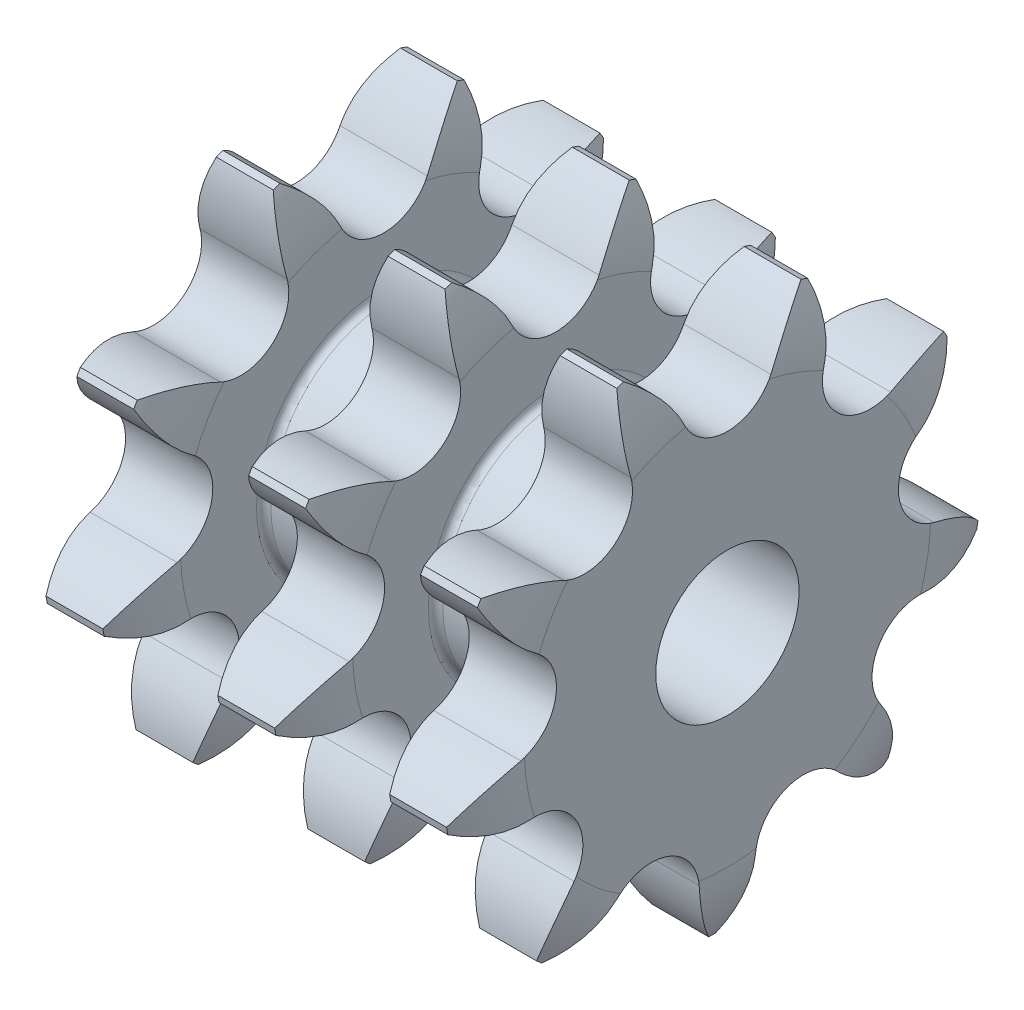
from build123d import *

# Parameters (mm, degrees)
GROOVES_COUNT   = 2
GROOVES_PITCH   = 14.38
TOOTHCUT_DEPTH  = 49.118649805
TEETHCUTS_COUNT = 9
TEETHCUTS_ANGLE = 320
BORSKE_R        = 6
BORE_DEPTH      = 38.2605


with BuildPart() as part:
    # BasProSke → Base-Revolve (revolve)
    with BuildSketch(Plane(origin=(0, 0, 0), x_dir=(1, 0, 0), z_dir=(0, 1, 0))):
        with BuildLine():
            Line((0, 0), (0, 16.992856303))
            ThreePointArc((0, 16.992856303), (0.321571182, 19.832662635), (1.27, 22.528657961))
            Line((1.27, 22.528657961), (34.79, 22.528657961))
            ThreePointArc((34.79, 22.528657961), (35.738428818, 19.832662635), (36.06, 16.992856303))
            Line((36.06, 16.992856303), (36.06, 0))
            Line((36.06, 0), (0, 0))
        make_face()
    revolve(axis=Axis((-10, 0, 0), (1, 0, 0)))

    # GrvSke → Groove (revolve, cut)
    with BuildSketch(Plane(origin=(0, 0, 0), x_dir=(1, 0, 0), z_dir=(0, 1, 0))):
        with BuildLine():
            Line((7.3, 16.992856303), (7.3, 10.646481635))
            ThreePointArc((7.3, 10.646481635), (7.475735931, 10.222217566), (7.9, 10.046481635))
            Line((7.9, 10.046481635), (13.78, 10.046481635))
            ThreePointArc((13.78, 10.046481635), (14.204264069, 10.222217566), (14.38, 10.646481635))
            Line((14.38, 10.646481635), (14.38, 16.992856303))
            ThreePointArc((14.38, 16.992856303), (14.701571182, 19.832662635), (15.65, 22.528657961))
            Line((15.65, 22.528657961), (6.03, 22.528657961))
            ThreePointArc((6.03, 22.528657961), (6.978428818, 19.832662635), (7.3, 16.992856303))
        make_face()
    groove = revolve(axis=Axis((0, 0, 0), (1, 0, 0)), mode=Mode.SUBTRACT)

    # Grooves: Groove ×2
    with Locations(*[(i * GROOVES_PITCH, 0, 0) for i in range(1, GROOVES_COUNT)]):
        add(groove, mode=Mode.SUBTRACT)

    # TooCutSke → ToothCut (cut, through all)
    with BuildSketch(Plane(origin=(0, 0, 0), x_dir=(0, 0, -1), z_dir=(1, 0, 0))):
        with BuildLine():
            ThreePointArc((3.638599188, 16.909201295), (5.440645741, 19.594585844), (7.97480479, 21.603739863))
            ThreePointArc((7.97480479, 21.603739863), (0, 23.028657961), (-7.97480479, 21.603739863))
            ThreePointArc((-7.97480479, 21.603739863), (-5.440645741, 19.594585844), (-3.638599188, 16.909201295))
            ThreePointArc((-3.638599188, 16.909201295), (0, 14.591157961), (3.638599188, 16.909201295))
        make_face()
    toothcut = extrude(amount=TOOTHCUT_DEPTH, mode=Mode.SUBTRACT)

    # TeethCuts: ToothCut ×9 about axis
    teethcuts_axis = Axis((-10, 0, 0), (1, 0, 0))
    for i in range(1, TEETHCUTS_COUNT):
        add(toothcut.rotate(teethcuts_axis, i * TEETHCUTS_ANGLE / (TEETHCUTS_COUNT - 1)), mode=Mode.SUBTRACT)

    # BorSke → Bore (cut, symmetric)
    with BuildSketch(Plane(origin=(0, 0, 0), x_dir=(0, 0, -1), z_dir=(1, 0, 0))):
        Circle(BORSKE_R)
    extrude(amount=BORE_DEPTH, both=True, mode=Mode.SUBTRACT)


solid = part.part
